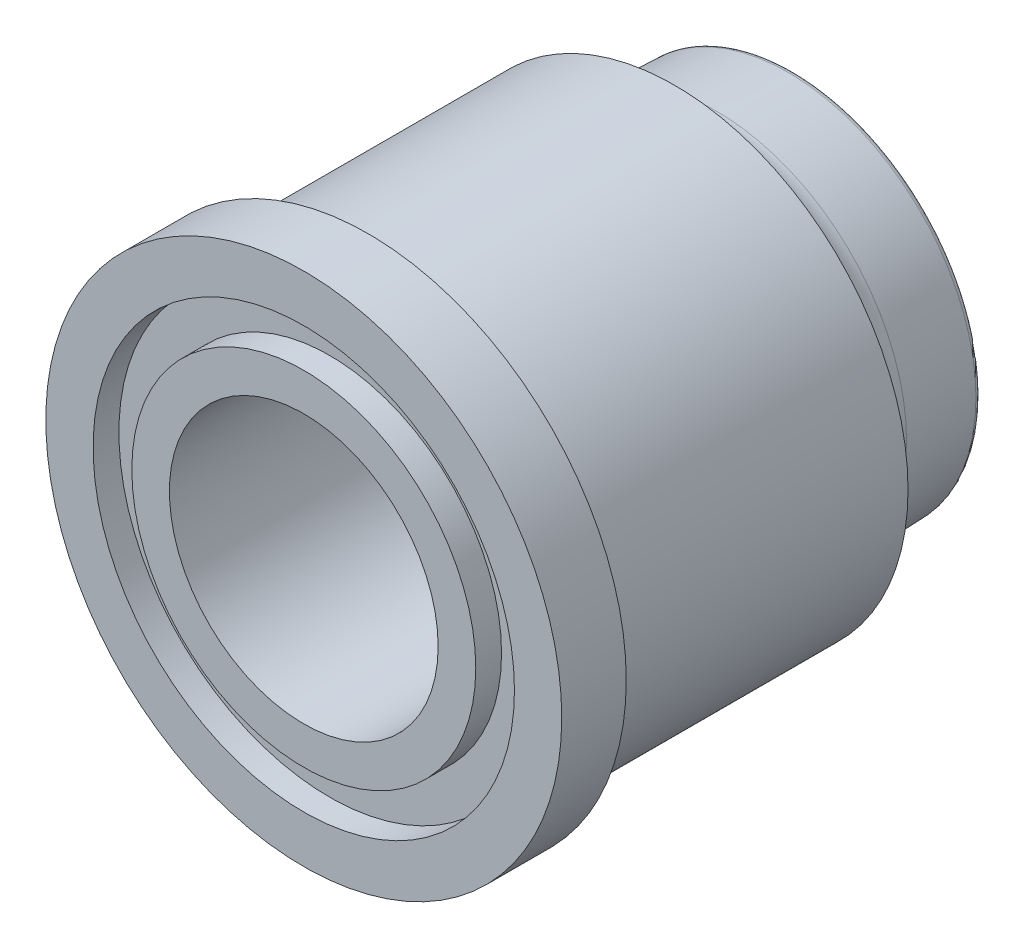
from build123d import *

# Parameters (mm, degrees)
SKETCH1_R      = 21.720880237
EXTRUDE1_DEPTH = 45.5475
SKETCH2_R      = 24
EXTRUDE2_DEPTH = 6
SKETCH3_R      = 12.5
EXTRUDE3_DEPTH = 38
SKETCH4_R      = 19.6
SKETCH4_R_2    = 16
EXTRUDE4_DEPTH = 2.4
FILLET1_R      = 2


# Read off the part's stored shape, not the designer's step: Cavity1
with BuildPart() as part:
    # Sketch1 → Extrude1 (new body)
    with BuildSketch(Plane.XY):
        Circle(SKETCH1_R)
    extrude(amount=-EXTRUDE1_DEPTH)

    # Cavity1 outline → Cavity1 (revolve, cut)
    with BuildSketch(Plane.XZ):
        with BuildLine():
            Line((21.720880237, -45.5475), (21.720880237, -34.4925))
            ThreePointArc((21.720880237, -34.4925), (18.928353588, -35.620754002), (17.703329112, -38.372204023))
            Line((17.703329112, -38.372204023), (17.469697537, -45.062536997))
            ThreePointArc((17.469697537, -45.062536997), (17.316569477, -45.406468249), (16.967503646, -45.5475))
            Line((16.967503646, -45.5475), (21.720880237, -45.5475))
        make_face()
    revolve(axis=Axis((0, 0, 0), (5.33833708127146e-12, -2.69575334284611e-12, 1.0)), mode=Mode.SUBTRACT)

    # Sketch2 → Extrude2 (add)
    with BuildSketch(Plane.XY):
        Circle(SKETCH2_R)
    extrude(amount=-EXTRUDE2_DEPTH)

    # Sketch3 → Extrude3 (cut)
    with BuildSketch(Plane.XY):
        Circle(SKETCH3_R)
    extrude(amount=-EXTRUDE3_DEPTH, mode=Mode.SUBTRACT)

    # Sketch4 → Extrude4 (cut)
    with BuildSketch(Plane.XY):
        Circle(SKETCH4_R)
        Circle(SKETCH4_R_2, mode=Mode.SUBTRACT)
    extrude(amount=-EXTRUDE4_DEPTH, mode=Mode.SUBTRACT)

    # Fillet1
    fillet1_edges = [part.edges().sort_by_distance(p)[0] for p in [
        (-12.5, 0, -38),
    ]]
    fillet(fillet1_edges, radius=FILLET1_R)


solid = part.part
